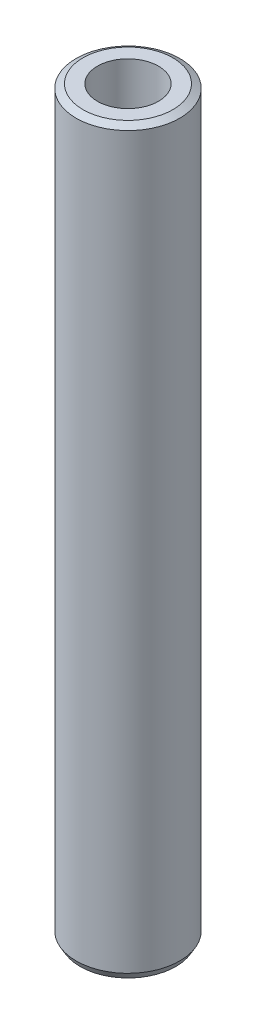
from build123d import *
from OCP.BRepFilletAPI import BRepFilletAPI_MakeChamfer

# Parameters (mm, degrees)
SKETCH1_R           = 27.5
BOSS_EXTRUDE1_DEPTH = 393.137035879
SKETCH2_R           = 16.201507672
CUT_EXTRUDE1_DEPTH  = 396.055982083
CHAMFER1_SIZE       = 2.105164015
CHAMFER1_SIZE2      = 3.646251032


with BuildPart() as part:
    # Sketch1 → Boss-Extrude1 (new body)
    with BuildSketch(Plane(origin=(0, 0, 0), x_dir=(1, 0, 0), z_dir=(0, 1, 0))):
        Circle(SKETCH1_R)
    extrude(amount=BOSS_EXTRUDE1_DEPTH)

    # Sketch2 → Cut-Extrude1 (cut, through all)
    with BuildSketch(Plane(origin=(0, 0, 0), x_dir=(1, 0, 0), z_dir=(0, 1, 0))):
        Circle(SKETCH2_R)
    extrude(amount=CUT_EXTRUDE1_DEPTH, mode=Mode.SUBTRACT)

    # Chamfer1: one chamfer whose edges measure the first distance from different faces: ONE call of the kernel's chamfer builder (chamfer() names one face for all edges)
    chamfer1_edges_1 = [part.edges().sort_by_distance(p)[0] for p in [
        (-27.5, 393.137035879, 0),
    ]]
    chamfer1_side_1 = [part.faces().sort_by_distance(p)[0] for p in [
        (-27.5, 196.568517939, 0),
    ]]
    chamfer1_edges_2 = [part.edges().sort_by_distance(p)[0] for p in [
        (-27.5, 0, 0),
    ]]
    chamfer1_side_2 = [part.faces().sort_by_distance(p)[0] for p in [
        (-26.722182541, 0, 0),
    ]]
    chamfer1 = BRepFilletAPI_MakeChamfer(part.part.solid().wrapped)
    for e in chamfer1_edges_1:
        chamfer1.Add(CHAMFER1_SIZE, CHAMFER1_SIZE2, e.wrapped, chamfer1_side_1[0].wrapped)  # the first distance lies on this face
    for e in chamfer1_edges_2:
        chamfer1.Add(CHAMFER1_SIZE, CHAMFER1_SIZE2, e.wrapped, chamfer1_side_2[0].wrapped)  # the first distance lies on this face
    add(Compound.cast(chamfer1.Shape()), mode=Mode.REPLACE)


solid = part.part
